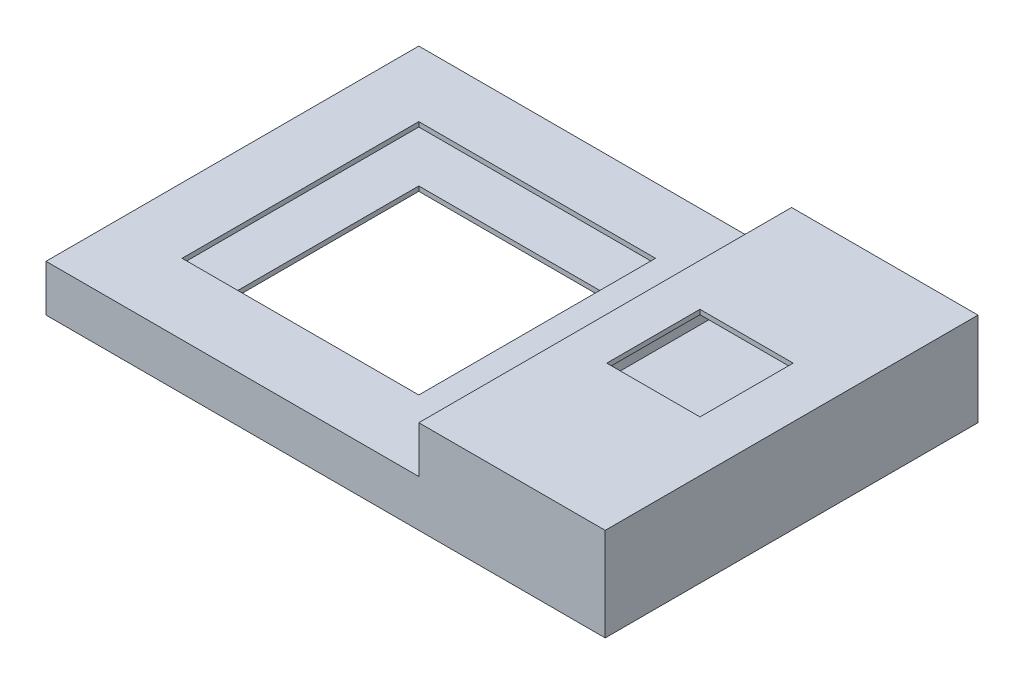
from build123d import *

# Parameters (mm, degrees)
SKETCH1_W                = 40
SKETCH1_H                = 40
SKETCH1_W_2              = 23
SKETCH1_H_2              = 23
BOSS_EXTRUDE1_DEPTH      = 5
BOSS_EXTRUDE2_DEPTH      = 5
BOSS_EXTRUDE2_DEPTH_BACK = 5
SKETCH1_4_W              = 20
SKETCH1_4_H              = 40
SKETCH2_W                = 25.4
SKETCH2_H                = 25.4
CUT_EXTRUDE1_DEPTH       = 0.5
CUT_EXTRUDE2_DEPTH       = 19.5
CUT_EXTRUDE2_DEPTH_BACK  = 19.5
SKETCH3_W                = 59
SKETCH3_H                = 4
CUT_EXTRUDE3_DEPTH       = 19.5
CUT_EXTRUDE3_DEPTH_BACK  = 19.5
SKETCH4_W                = 10
SKETCH4_H                = 10
CUT_EXTRUDE4_DEPTH       = 2


with BuildPart() as part:
    # Sketch1 → Boss-Extrude1 (new body)
    with BuildSketch(Plane(origin=(0, 0, 0), x_dir=(1, 0, 0), z_dir=(0, 1, 0))):
        Rectangle(SKETCH1_W, SKETCH1_H)
        Rectangle(SKETCH1_W_2, SKETCH1_H_2, mode=Mode.SUBTRACT)
    extrude(amount=-BOSS_EXTRUDE1_DEPTH)

    # Sketch1<4> → Boss-Extrude2 (add, two sides: drawn at the far end of the back side and taken through both)
    with BuildSketch(Plane(origin=(0, 0, 0), x_dir=(1, 0, 0), z_dir=(0, 1, 0)).offset(-BOSS_EXTRUDE2_DEPTH_BACK)):
        with Locations((30, 0)):
            Rectangle(SKETCH1_4_W, SKETCH1_4_H)
    extrude(amount=BOSS_EXTRUDE2_DEPTH + BOSS_EXTRUDE2_DEPTH_BACK)

    # Sketch2 → Cut-Extrude1 (cut)
    with BuildSketch(Plane(origin=(0, 0, 0), x_dir=(1, 0, 0), z_dir=(0, 1, 0))):
        with Locations((-0.278388484, 0.278388484)):
            Rectangle(SKETCH2_W, SKETCH2_H)
    extrude(amount=-CUT_EXTRUDE1_DEPTH, mode=Mode.SUBTRACT)

    # Sketch3 → Cut-Extrude2 (cut, two sides: drawn at the far end of the back side and taken through both)
    with BuildSketch(Plane.XY.offset(-CUT_EXTRUDE2_DEPTH_BACK)):
        with Locations((10, -2.5)):
            Rectangle(SKETCH3_W, SKETCH3_H)
    extrude(amount=CUT_EXTRUDE2_DEPTH + CUT_EXTRUDE2_DEPTH_BACK, mode=Mode.SUBTRACT)

    # Sketch5 → Cut-Extrude3 (cut, two sides: drawn at the far end of the back side and taken through both)
    with BuildSketch(Plane.XY.offset(-CUT_EXTRUDE3_DEPTH_BACK)):
        Polygon((39.5, -4.5), (20.5, -4.5), (20, -4.5), (20, -0.5), (20.5, -0.5), (20.5, 4.5), (39.5, 4.5), align=None)
    extrude(amount=CUT_EXTRUDE3_DEPTH + CUT_EXTRUDE3_DEPTH_BACK, mode=Mode.SUBTRACT)

    # Sketch4 → Cut-Extrude4 (cut)
    with BuildSketch(Plane(origin=(0, 5, 0), x_dir=(1, 0, 0), z_dir=(0, 1, 0))):
        with Locations((29.545931586, 0.622908533)):
            Rectangle(SKETCH4_W, SKETCH4_H)
    extrude(amount=-CUT_EXTRUDE4_DEPTH, mode=Mode.SUBTRACT)


solid = part.part
